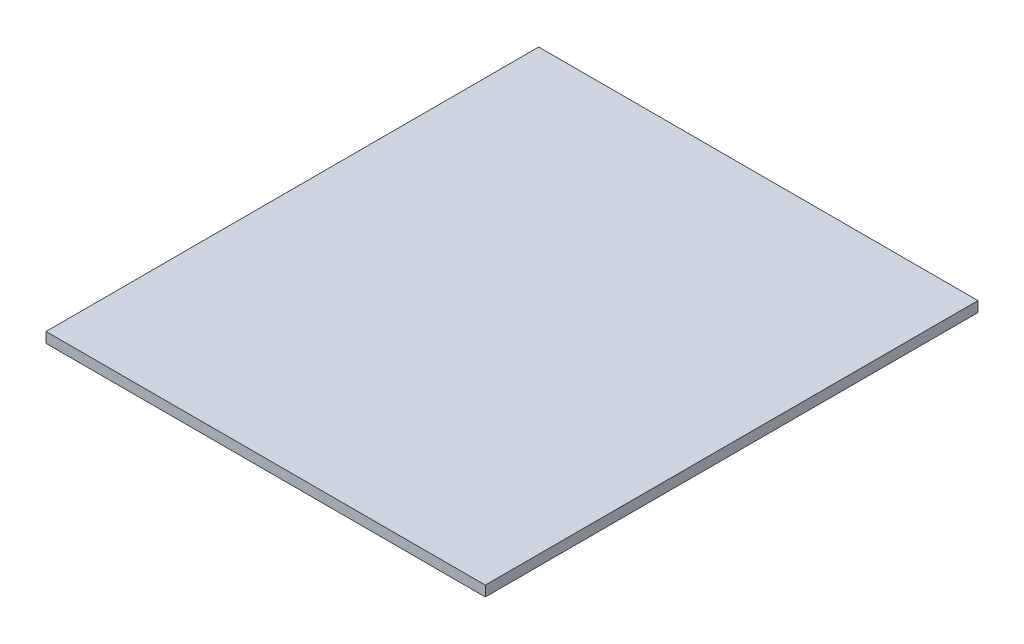
from build123d import *

# Parameters (mm, degrees)
SKETCH1_W           = 255
SKETCH1_H           = 286
BOSS_EXTRUDE1_DEPTH = 5.9944


with BuildPart() as part:
    # Sketch1 → Boss-Extrude1 (new body)
    with BuildSketch(Plane(origin=(0, 0, 0), x_dir=(1, 0, 0), z_dir=(0, 1, 0))):
        with Locations((127.5, 143)):
            Rectangle(SKETCH1_W, SKETCH1_H)
    extrude(amount=BOSS_EXTRUDE1_DEPTH)


solid = part.part
